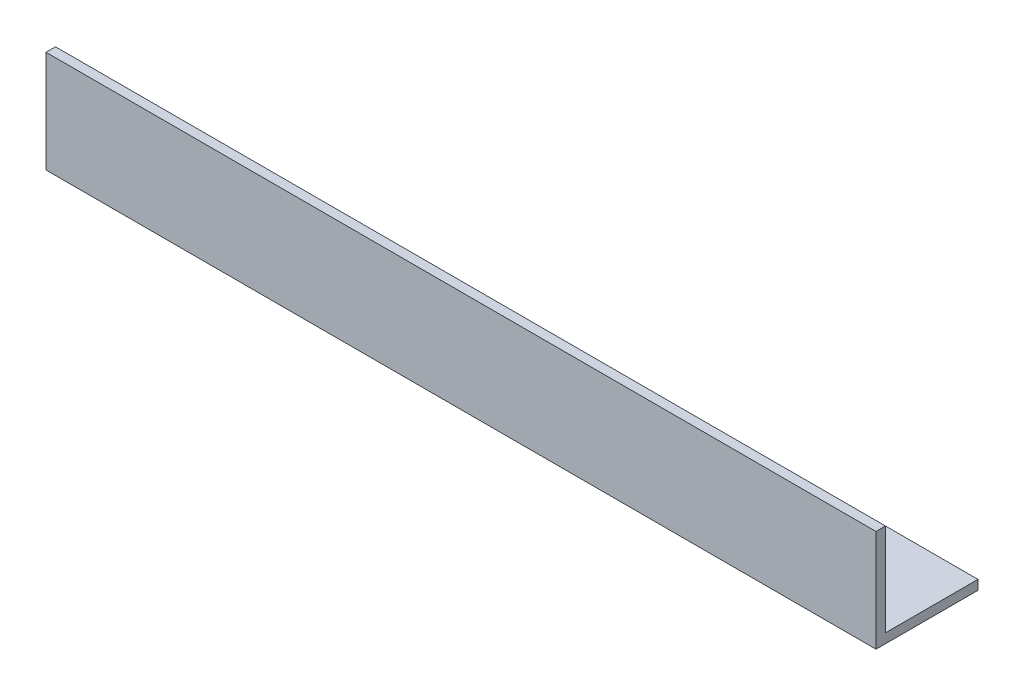
from build123d import *

# Parameters (mm, degrees)
EXTRUDE_1_DEPTH = 350


with BuildPart() as part:
    # Эскиз1 → Вытянуть-Тонкостенный1 (new body)
    with BuildSketch(Plane(origin=(0, 0, 0), x_dir=(0, 0, -1), z_dir=(1, 0, 0))):
        Polygon((0, 43), (0, 0), (43, 0), (43, 4), (4, 4), (4, 43), align=None)
    extrude(amount=EXTRUDE_1_DEPTH)


solid = part.part
